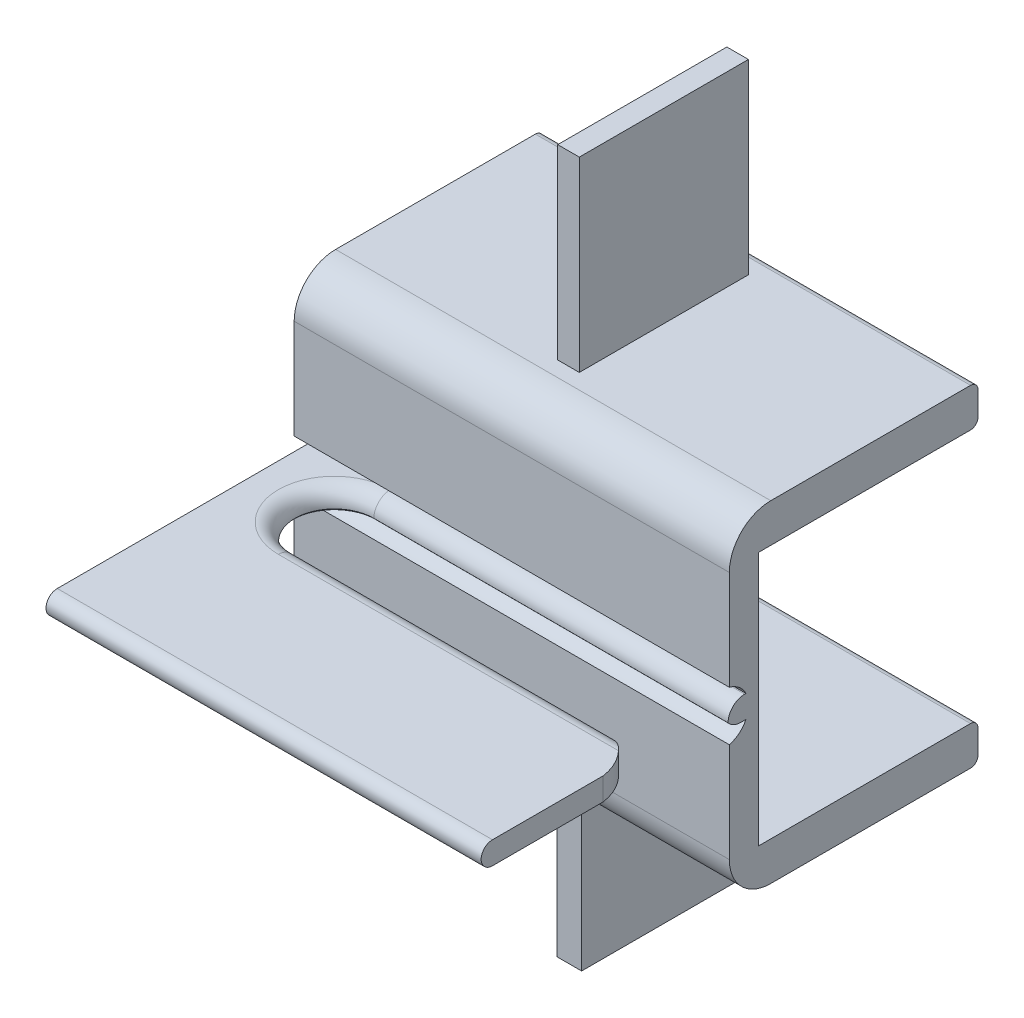
from build123d import *

# Parameters (mm, degrees)
RESSALTO_EXTRUS_O1_DEPTH = 5.25
CORTE_EXTRUS_O1_DEPTH    = 5.25
CORTE_EXTRUS_O2_DEPTH    = 5.25
FILETE1_R                = 0.2
FILETE2_R                = 0.2
ESBO_O5_W                = 0.260533882
ESBO_O5_H                = 2.040360402
RESSALTO_EXTRUS_O2_DEPTH = 2.25
ESBO_O6_W                = 0.29646959
ESBO_O6_H                = 2.02037459
RESSALTO_EXTRUS_O3_DEPTH = 2.25


with BuildPart() as part:
    # Esboço1 → Ressalto-extrusão1 (new body)
    with BuildSketch(Plane(origin=(0, 0, 0), x_dir=(0, 0, -1), z_dir=(1, 0, 0))):
        with BuildLine():
            Line((1.15, 1.533333333), (1.41, 1.533333333))
            ThreePointArc((1.41, 1.533333333), (1.47363961, 1.559693723), (1.5, 1.623333333))
            Line((1.5, 1.623333333), (1.5, 1.91))
            ThreePointArc((1.5, 1.91), (1.47363961, 1.97363961), (1.41, 2))
            Line((1.41, 2), (-1, 2))
            ThreePointArc((-1, 2), (-1.353553391, 1.853553391), (-1.5, 1.5))
            Line((-1.5, 1.5), (-1.5, 0.3))
            ThreePointArc((-1.5, 0.3), (-1.382013537, 0.239983106), (-1.299811944, 0.136225065))
            Line((-1.299811944, 0.136225065), (-4.357674279, 0.136225065))
            ThreePointArc((-4.357674279, 0.136225065), (-4.493899344, 0), (-4.357674279, -0.136225065))
            Line((-4.357674279, -0.136225065), (-1.299811944, -0.136225065))
            ThreePointArc((-1.299811944, -0.136225065), (-1.382013537, -0.239983106), (-1.5, -0.3))
            Line((-1.5, -0.3), (-1.5, -1.5))
            ThreePointArc((-1.5, -1.5), (-1.353553391, -1.853553391), (-1, -2))
            Line((-1, -2), (1.41, -2))
            ThreePointArc((1.41, -2), (1.47363961, -1.97363961), (1.5, -1.91))
            Line((1.5, -1.91), (1.5, -1.623333333))
            ThreePointArc((1.5, -1.623333333), (1.47363961, -1.559693723), (1.41, -1.533333333))
            Line((1.41, -1.533333333), (1.15, -1.533333333))
            Line((1.15, -1.533333333), (-1.15, -1.533333333))
            Line((-1.15, -1.533333333), (-1.15, 1.533333333))
            Line((-1.15, 1.533333333), (1.15, 1.533333333))
        make_face()
    extrude(amount=RESSALTO_EXTRUS_O1_DEPTH)

    # Esboço3 → Corte-extrusão1 (cut)
    with BuildSketch(Plane(origin=(0, 0.136225065, 0), x_dir=(1, 0, 0), z_dir=(0, 1, 0))):
        with BuildLine():
            Line((0.9764494, -1.514917526), (7.89407317, -1.514917526))
            ThreePointArc((7.89407317, -1.514917526), (8.3702213, -1.991065656), (7.89407317, -2.467213785))
            Line((7.89407317, -2.467213785), (0.9764494, -2.467213785))
            ThreePointArc((0.9764494, -2.467213785), (0.500301271, -1.991065656), (0.9764494, -1.514917526))
        make_face()
    extrude(amount=-CORTE_EXTRUS_O1_DEPTH, mode=Mode.SUBTRACT)

    # Esboço4 → Corte-extrusão2 (cut)
    with BuildSketch(Plane(origin=(0, 0.136225065, 0), x_dir=(1, 0, 0), z_dir=(0, 1, 0))):
        with BuildLine():
            Line((4.695795168, -2.467213785), (4.884457634, -1.937162094))
            Line((4.884457634, -1.937162094), (6.007448506, -2.098872779))
            Line((6.007448506, -2.098872779), (6.375789512, -3.266783286))
            Line((6.375789512, -3.266783286), (5.25, -3.203895797))
            ThreePointArc((5.25, -3.203895797), (5.125469424, -2.720775212), (4.695795168, -2.467213785))
        make_face()
    extrude(amount=-CORTE_EXTRUS_O2_DEPTH, mode=Mode.SUBTRACT)

    # Filete1
    filete1_edges = [part.edges().sort_by_distance(p)[0] for p in [
        (2.836122284, 0.136225065, 2.467213785),
        (3.1132247, 0.136225065, 1.514917526),
        (0.500301271, 0.136225065, 1.991065656),
    ]]
    fillet(filete1_edges, radius=FILETE1_R)

    # Filete2
    # the kernel refuses this fillet: 0.2 mm, written as the material it takes off along each edge
    with BuildSketch(Plane(origin=(5.080917151, -0.136225065, 2.467213785), x_dir=(0, 0, 1), z_dir=(-1, 0, 0))) as filete2_piece_1:
        with BuildLine():
            CenterArc((0.154048793, 0.2), FILETE2_R, 219.624198081, 50.375801919)
            Line((0, 0.07245013), (-0.003080976, 0.069899133))
            ThreePointArc((-0.003080976, 0.069899133), (-0.004, 0.036225065), (-0.004, 0))
            Line((-0.004, 0), (0, -0.004))
            Line((0, -0.004), (0.154048793, -0.004))
            Line((0.154048793, -0.004), (0.154048793, 0))
        make_face()
    extrude(amount=4.104467751, mode=Mode.SUBTRACT)
    with BuildSketch(Plane(origin=(0.9764494, -0.136225065, 1.991065656), x_dir=(0, 0, -1), z_dir=(1, 0, 0))) as filete2_piece_2:
        with BuildLine():
            CenterArc((0.630196923, 0.2), FILETE2_R, 219.624198081, 50.375801919)
            Line((0.47614813, 0.07245013), (0.473067154, 0.069899133))
            ThreePointArc((0.473067154, 0.069899133), (0.47214813, 0.036225065), (0.47214813, 0))
            Line((0.47214813, 0), (0.47614813, -0.004))
            Line((0.47614813, -0.004), (0.630196923, -0.004))
            Line((0.630196923, -0.004), (0.630196923, 0))
        make_face()
    revolve(axis=Axis((0.9764494, -0.136225065, 1.991065656), (0, 1, 0)), revolution_arc=180, mode=Mode.SUBTRACT)
    with BuildSketch(Plane(origin=(0.9764494, -0.136225065, 1.514917526), x_dir=(0, 1, 0), z_dir=(1, 0, 0))) as filete2_piece_3:
        with BuildLine():
            CenterArc((0.2, -0.154048793), FILETE2_R, 129.624198081, 50.375801919)
            Line((0, -0.154048793), (-0.004, -0.154048793))
            Line((-0.004, -0.154048793), (-0.004, 0))
            Line((-0.004, 0), (0, 0.004))
            ThreePointArc((0, 0.004), (0.036225065, 0.004), (0.069899133, 0.003080976))
            Line((0.069899133, 0.003080976), (0.07245013, 0))
        make_face()
    extrude(amount=4.658672583, mode=Mode.SUBTRACT)

    # Esboço5 → Ressalto-extrusão2 (add)
    with BuildSketch(Plane(origin=(0, 2, 0), x_dir=(1, 0, 0), z_dir=(0, 1, 0))):
        with Locations((2.625, 0.205)):
            Rectangle(ESBO_O5_W, ESBO_O5_H)
    extrude(amount=RESSALTO_EXTRUS_O2_DEPTH)

    # Esboço6 → Ressalto-extrusão3 (add)
    with BuildSketch(Plane.XZ.offset(2)):
        with Locations((2.625, -0.205)):
            Rectangle(ESBO_O6_W, ESBO_O6_H)
    extrude(amount=RESSALTO_EXTRUS_O3_DEPTH)


solid = part.part
